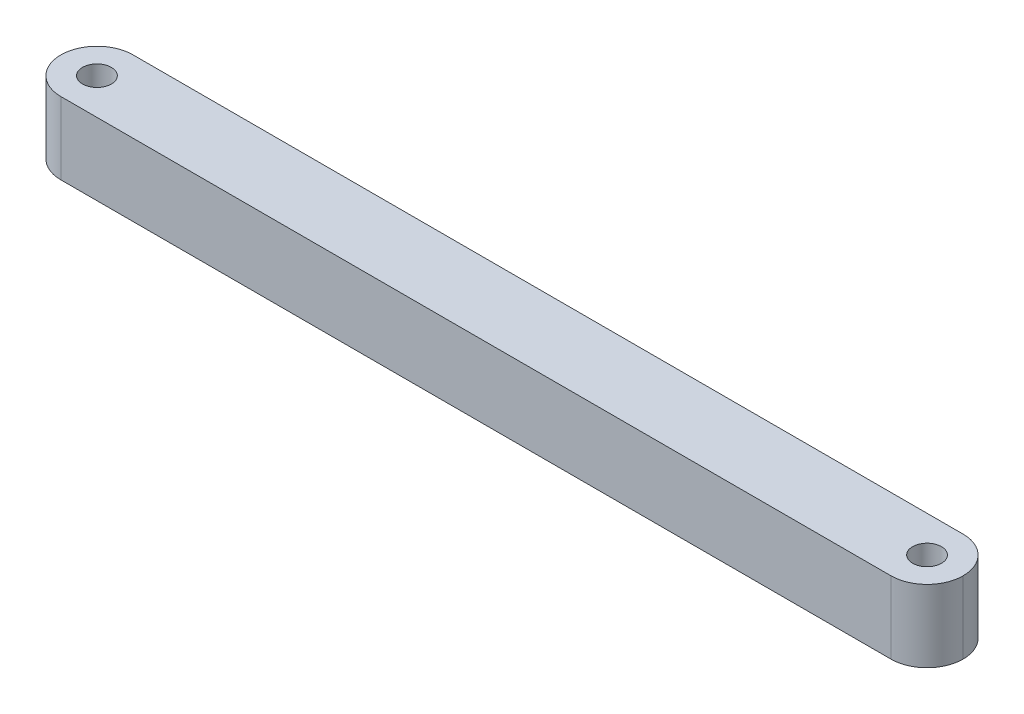
from build123d import *

# Parameters (mm, degrees)
SKETCH_1_W          = 125
SKETCH_1_H          = 10
EXTRUDE_1_DEPTH     = 10
FILLET_1_R          = 5
SKETCH_2_R          = 2
CUT_EXTRUDE_1_DEPTH = 10


with BuildPart() as part:
    # 스케치1 → 보스-돌출1 (new body)
    with BuildSketch(Plane.XY):
        Rectangle(SKETCH_1_W, SKETCH_1_H)
    extrude(amount=EXTRUDE_1_DEPTH)

    # 필렛1
    fillet_1_edges = [part.edges().sort_by_distance(p)[0] for p in [
        (62.5, 0, 10),
        (62.5, 0, 0),
        (-62.5, 0, 0),
        (-62.5, 0, 10),
    ]]
    fillet(fillet_1_edges, radius=FILLET_1_R - 0.0001)  # a hair under: the kernel refuses the full size

    # 스케치2 → 컷-돌출1 (cut)
    with BuildSketch(Plane(origin=(0, 5, 0), x_dir=(1, 0, 0), z_dir=(0, 1, 0))):
        with Locations(Location((-57.5, -5, 0), (0, 0, 270))):
            Circle(SKETCH_2_R)
        with Locations(Location((57.5, -5, 0), (0, 0, 270))):
            Circle(SKETCH_2_R)
    extrude(amount=-CUT_EXTRUDE_1_DEPTH, mode=Mode.SUBTRACT)


solid = part.part
